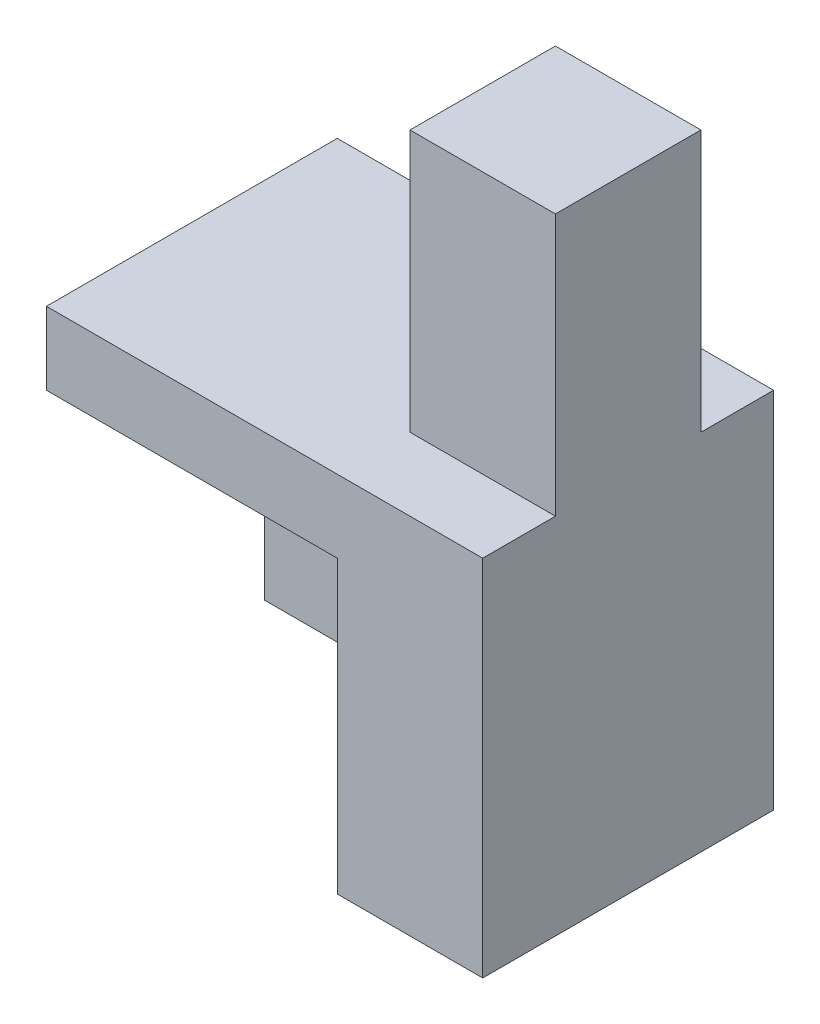
from build123d import *

# Parameters (mm, degrees)
BOSS_EXTRUDE3_DEPTH = 10
SKETCH4_W           = 30
SKETCH4_H           = 25
BOSS_EXTRUDE4_DEPTH = 5
BOSS_EXTRUDE5_DEPTH = 5


with BuildPart() as part:
    # Sketch3 → Boss-Extrude3 (new body)
    with BuildSketch(Plane.XY):
        Polygon((0, 0), (0, -5), (20, -5), (20, -25), (30, -25), (30, 18), (20, 18), (20, 0), align=None)
    extrude(amount=BOSS_EXTRUDE3_DEPTH)

    # Sketch4 → Boss-Extrude4 (add)
    with BuildSketch(Plane(origin=(0, 0, 0), x_dir=(-1, 0, 0), z_dir=(0, 0, -1))):
        with Locations((-15, -12.5)):
            Rectangle(SKETCH4_W, SKETCH4_H)
    extrude(amount=BOSS_EXTRUDE4_DEPTH)

    # Sketch5 → Boss-Extrude5 (add)
    with BuildSketch(Plane.XY.offset(10)):
        Polygon((0, 0), (0, -5), (20, -5), (20, -25), (30, -25), (30, 0), align=None)
    extrude(amount=BOSS_EXTRUDE5_DEPTH)


solid = part.part
